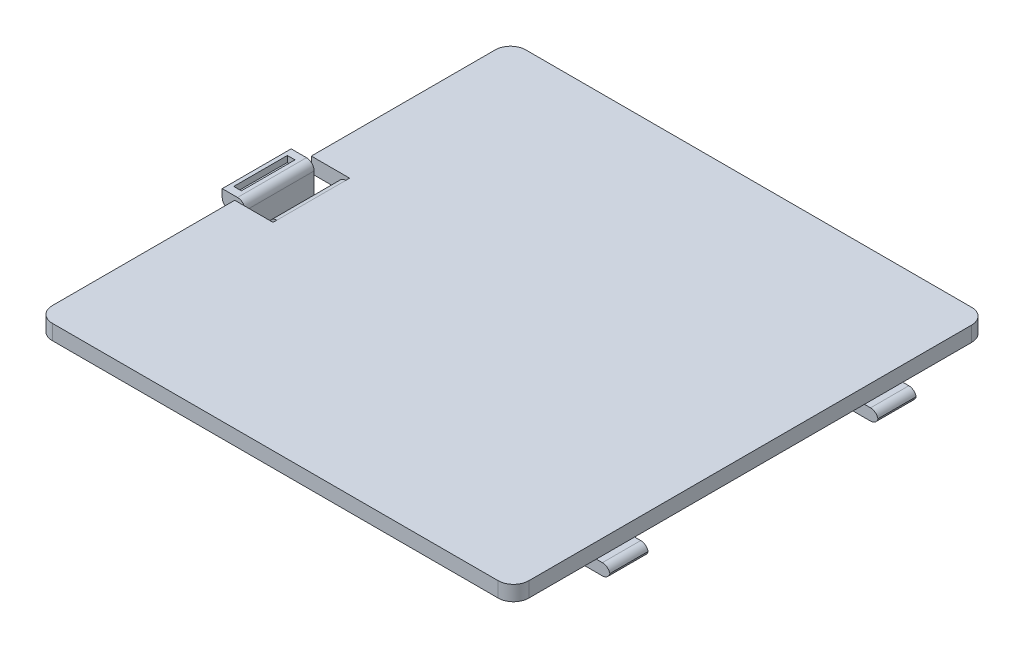
from build123d import *

# Parameters (mm, degrees)
BOSS_EXTRUDE1_DEPTH  = 5
SKETCH8_W            = 12.7
SKETCH8_H            = 25.4
CUT_EXTRUDE1_DEPTH   = 12.7
BOSS_EXTRUDE6_START  = 1.27
BOSS_EXTRUDE6_DEPTH  = 22.86
FILLET3_R            = 2.54
SKETCH12_W           = 22.86
SKETCH12_H           = 5.08
BOSS_EXTRUDE7_DEPTH  = 5.08
FILLET8_R            = 2.54
SKETCH13_W           = 2.54
SKETCH13_H           = 17.78
CUT_EXTRUDE2_DEPTH   = 2.032
BOSS_EXTRUDE8_DEPTH  = 22.86
FILLET5_R            = 2.54
FILLET6_R            = 2.54
BOSS_EXTRUDE9_START  = -27.94
SKETCH15_W           = 10.16
SKETCH15_H           = 3.81
BOSS_EXTRUDE9_DEPTH  = 12.7
BOSS_EXTRUDE10_START = -116.84
SKETCH15_2_W         = 10.16
SKETCH15_2_H         = 3.81
BOSS_EXTRUDE10_DEPTH = 12.7
FILLET7_R            = 2.54


with BuildPart() as part:
    # Sketch2 → Boss-Extrude1 (new body)
    with BuildSketch(Plane(origin=(0, 0, 0), x_dir=(1, 0, 0), z_dir=(0, 1, 0))):
        with BuildLine():
            Line((-98.109845206, -87.510053172), (49.730154794, -87.510053172))
            ThreePointArc((49.730154794, -87.510053172), (53.322257243, -86.02215562), (54.810154794, -82.430053172))
            Line((54.810154794, -82.430053172), (54.810154794, 64.409946828))
            ThreePointArc((54.810154794, 64.409946828), (53.322257243, 68.002049277), (49.730154794, 69.489946828))
            Line((49.730154794, 69.489946828), (-98.109845206, 69.489946828))
            ThreePointArc((-98.109845206, 69.489946828), (-101.701947654, 68.002049277), (-103.189845206, 64.409946828))
            Line((-103.189845206, 64.409946828), (-103.189845206, -82.430053172))
            ThreePointArc((-103.189845206, -82.430053172), (-101.701947654, -86.02215562), (-98.109845206, -87.510053172))
        make_face()
    extrude(amount=BOSS_EXTRUDE1_DEPTH)

    # Sketch8 → Cut-Extrude1 (cut)
    with BuildSketch(Plane(origin=(0, 5, 0), x_dir=(1, 0, 0), z_dir=(0, 1, 0))):
        with Locations((-96.839845206, -9.250053172)):
            Rectangle(SKETCH8_W, SKETCH8_H)
    extrude(amount=-CUT_EXTRUDE1_DEPTH, mode=Mode.SUBTRACT)

    # Sketch9 → Boss-Extrude6 (add)
    with BuildSketch(Plane(origin=(0, 0, 21.950053172), x_dir=(-1, 0, 0), z_dir=(0, 0, -1)).offset(BOSS_EXTRUDE6_START)):
        with BuildLine():
            Line((90.489845206, 5), (90.489845206, -9.510091846))
            ThreePointArc((90.489845206, -9.510091846), (91.233793982, -11.30614307), (93.029845206, -12.050091846))
            Line((93.029845206, -12.050091846), (100.984663509, -12.050091846))
            ThreePointArc((100.984663509, -12.050091846), (102.780714734, -11.30614307), (103.524663509, -9.510091846))
            Line((103.524663509, -9.510091846), (103.524663509, 5))
            Line((103.524663509, 5), (100.984663509, 5))
            Line((100.984663509, 5), (100.984663509, -6.970091846))
            ThreePointArc((100.984663509, -6.970091846), (100.240714734, -8.76614307), (98.444663509, -9.510091846))
            Line((98.444663509, -9.510091846), (97.007254358, -9.510091846))
            add(Edge.make_bspline(
                [(93.029845206, -3.470974905), (93.181288834, -7.756398779), (97.007254358, -9.510091846)],
                knots=[0, 0, 0, 1, 1, 1], degree=2))
            Line((93.029845206, -3.470974905), (93.029845206, 5))
            Line((93.029845206, 5), (90.489845206, 5))
        make_face()
    extrude(amount=BOSS_EXTRUDE6_DEPTH)

    # Fillet3
    fillet3_edges = [part.edges().sort_by_distance(p)[0] for p in [
        (-90.489845206, 0, 9.250053172),
    ]]
    fillet(fillet3_edges, radius=FILLET3_R)

    # Sketch12 → Boss-Extrude7 (add)
    with BuildSketch(Plane.ZY.offset(103.524663509)):
        with Locations((9.250053172, 2.46)):
            Rectangle(SKETCH12_W, SKETCH12_H)
    extrude(amount=BOSS_EXTRUDE7_DEPTH)

    # Fillet8
    fillet8_edges = [part.edges().sort_by_distance(p)[0] for p in [
        (-100.984663509, 5, 9.250053172),
    ]]
    fillet(fillet8_edges, radius=FILLET8_R)

    # Sketch13 → Cut-Extrude2 (cut)
    with BuildSketch(Plane(origin=(0, 5, 0), x_dir=(1, 0, 0), z_dir=(0, 1, 0))):
        with Locations((-106.064663509, -9.250053172)):
            Rectangle(SKETCH13_W, SKETCH13_H)
    extrude(amount=-CUT_EXTRUDE2_DEPTH, mode=Mode.SUBTRACT)

    # Sketch14 → Boss-Extrude8 (add)
    with BuildSketch(Plane(origin=(0, 0, -2.179946828), x_dir=(-1, 0, 0), z_dir=(0, 0, -1))):
        Polygon((103.524663509, -4.576775108), (105.048663509, -4.576775108), (103.524663509, -7.370775108), align=None)
    extrude(amount=-BOSS_EXTRUDE8_DEPTH)

    # Fillet5
    fillet5_edges = [part.edges().sort_by_distance(p)[0] for p in [
        (-93.029845206, 5, 9.250053172),
    ]]
    fillet(fillet5_edges, radius=FILLET5_R)

    # Fillet6
    fillet6_edges = [part.edges().sort_by_distance(p)[0] for p in [
        (-108.604663509, -0.08, 9.250053172),
    ]]
    fillet(fillet6_edges, radius=FILLET6_R)

    # Sketch15 → Boss-Extrude9 (add)
    with BuildSketch(Plane(origin=(0, 0, -69.489946828), x_dir=(-1, 0, 0), z_dir=(0, 0, -1)).offset(BOSS_EXTRUDE9_START)):
        with Locations((-54.290154794, -1.905)):
            Rectangle(SKETCH15_W, SKETCH15_H)
    extrude(amount=-BOSS_EXTRUDE9_DEPTH)

    # Sketch15<2> → Boss-Extrude10 (add)
    with BuildSketch(Plane(origin=(0, 0, -69.489946828), x_dir=(-1, 0, 0), z_dir=(0, 0, -1)).offset(BOSS_EXTRUDE10_START)):
        with Locations((-54.290154794, -1.905)):
            Rectangle(SKETCH15_2_W, SKETCH15_2_H)
    extrude(amount=-BOSS_EXTRUDE10_DEPTH)

    # Fillet7
    # the kernel refuses this fillet: 2.54 mm, written as the material it adds along each edge
    with BuildSketch(Plane(origin=(49.210154794, 0, 47.350053172), x_dir=(-1, 0, 0), z_dir=(0, 0, 1)), Plane(origin=(49.210154794, 0, -41.549946828), x_dir=(-1, 0, 0), z_dir=(0, 0, 1))) as fillet7_piece_1:
        with BuildLine():
            CenterArc((FILLET7_R, FILLET7_R), FILLET7_R, 180, 90)
            Line((0, FILLET7_R), (0, 0))
            Line((0, 0), (FILLET7_R, 0))
        make_face()
    extrude(amount=12.7)
    # the kernel refuses this fillet: 2.54 mm, written as the material it takes off along each edge
    with BuildSketch(Plane(origin=(59.370154794, 0, 41.000053172), x_dir=(-1, 0, 0), z_dir=(0, 0, 1)), Plane(origin=(59.370154794, -3.81, 41.000053172), x_dir=(0, 1, 0), z_dir=(0, 0, 1)), Plane(origin=(59.370154794, -3.81, -47.899946828), x_dir=(0, 1, 0), z_dir=(0, 0, 1)), Plane(origin=(59.370154794, 0, -47.899946828), x_dir=(-1, 0, 0), z_dir=(0, 0, 1))) as fillet7_2_piece_1:
        with BuildLine():
            CenterArc((FILLET7_R, FILLET7_R), FILLET7_R, 180, 90)
            Line((0, FILLET7_R), (0, 0))
            Line((0, 0), (FILLET7_R, 0))
        make_face()
    extrude(amount=25.4, mode=Mode.SUBTRACT)


solid = part.part
